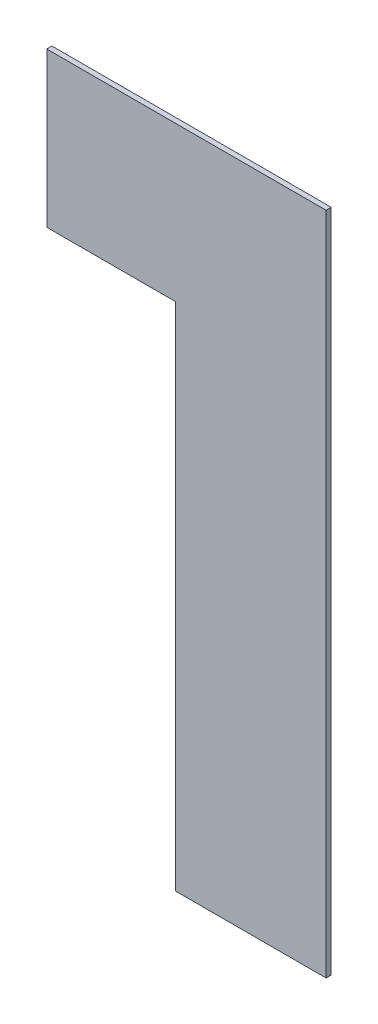
from build123d import *

# Parameters (mm, degrees)
TABAN_FLAN_1_DEPTH = 30
IZIM3_W            = 878
IZIM3_H            = 1001
SEKME1_DEPTH       = 30


# Sheet-metal steps are written as plain solids
with BuildPart() as part:
    # Çizim1 → Taban-Flanş1 (new body)
    with BuildSketch(Plane.XY):
        Polygon((0, 0), (0, -900), (750, -900), (750, -2874), (1628, -2874), (1628, 0), align=None)
    extrude(amount=-TABAN_FLAN_1_DEPTH)

    # Çizim3 → Sekme1 (add)
    with BuildSketch(Plane.XY):
        with Locations((1189, -3374.5)):
            Rectangle(IZIM3_W, IZIM3_H)
    extrude(amount=-SEKME1_DEPTH)


solid = part.part
